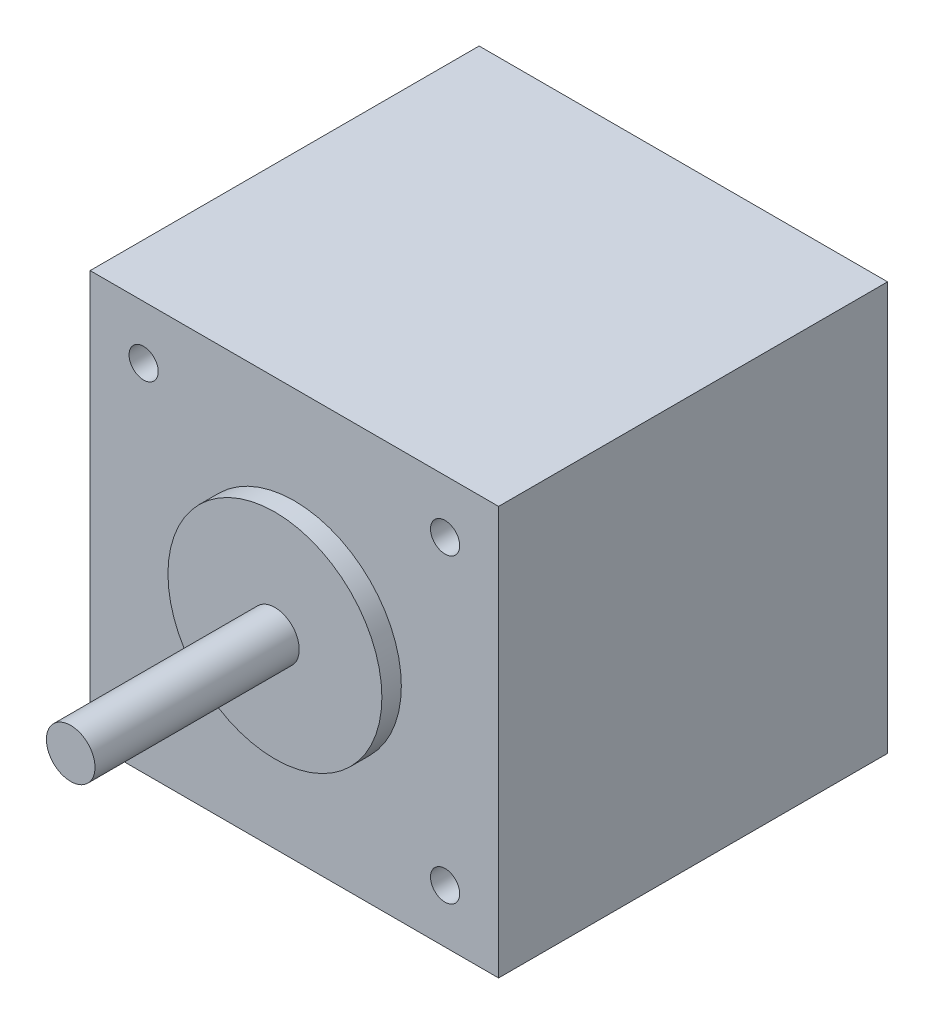
from build123d import *

# Parameters (mm, degrees)
SKETCH_1_W          = 42
SKETCH_1_H          = 42
EXTRUDE_1573_DEPTH  = 40
SKETCH_2_R          = 2.5
EXTRUDE_1628_DEPTH  = 63
SKETCH_3_R          = 11
EXTRUDE_1675_DEPTH  = 42
CUT_EXTRUDE_START   = 40
SKETCH_4_R          = 1.5
CUT_EXTRUDE_3_DEPTH = 4.5


with BuildPart() as part:
    # Эскиз1 → Extrude 1573 (new body)
    with BuildSketch(Plane.XY):
        Rectangle(SKETCH_1_W, SKETCH_1_H)
    extrude(amount=EXTRUDE_1573_DEPTH)

    # Эскиз2 → Extrude 1628 (add)
    with BuildSketch(Plane.XY):
        Circle(SKETCH_2_R)
    extrude(amount=EXTRUDE_1628_DEPTH)

    # Эскиз3 → Extrude 1675 (add)
    with BuildSketch(Plane.XY):
        Circle(SKETCH_3_R)
    extrude(amount=EXTRUDE_1675_DEPTH)

    # Эскиз4 → Крепеж_М3_ПРЕДВ (cut)
    with BuildSketch(Plane.XY.offset(CUT_EXTRUDE_START)):
        with Locations((-15.5, -15.5)):
            Circle(SKETCH_4_R)
        with Locations((-15.5, 15.5)):
            Circle(SKETCH_4_R)
        with Locations((15.5, -15.5)):
            Circle(SKETCH_4_R)
        with Locations((15.5, 15.5)):
            Circle(SKETCH_4_R)
    extrude(amount=-CUT_EXTRUDE_3_DEPTH, mode=Mode.SUBTRACT)


solid = part.part
